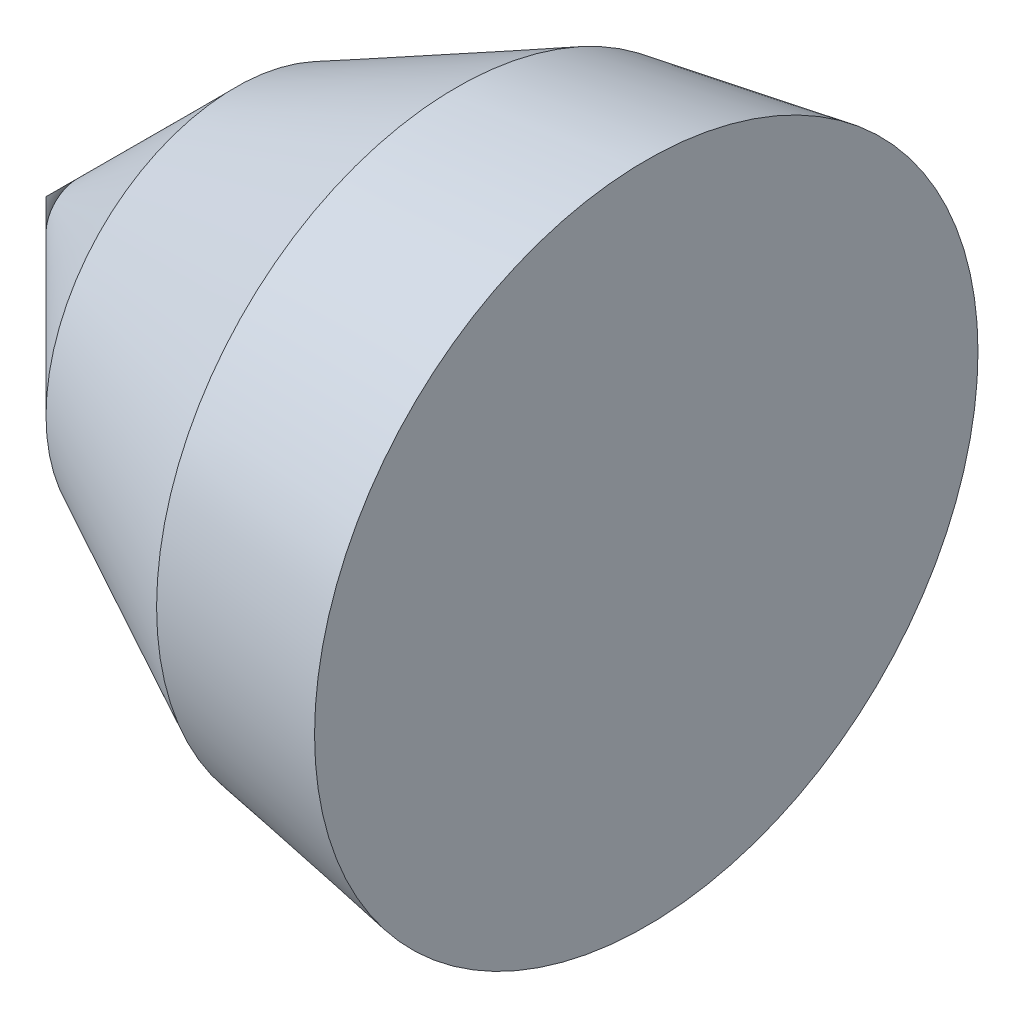
from build123d import *


with BuildPart() as part:
    # Sketch1 → Revolve1 (revolve)
    with BuildSketch(Plane.XY):
        Polygon((0, 0), (0, 21), (-12, 19), (-26, 12), (-38, 0), align=None)
    revolve(axis=Axis((-10, 0, 0), (1, 0, 0)))


solid = part.part
